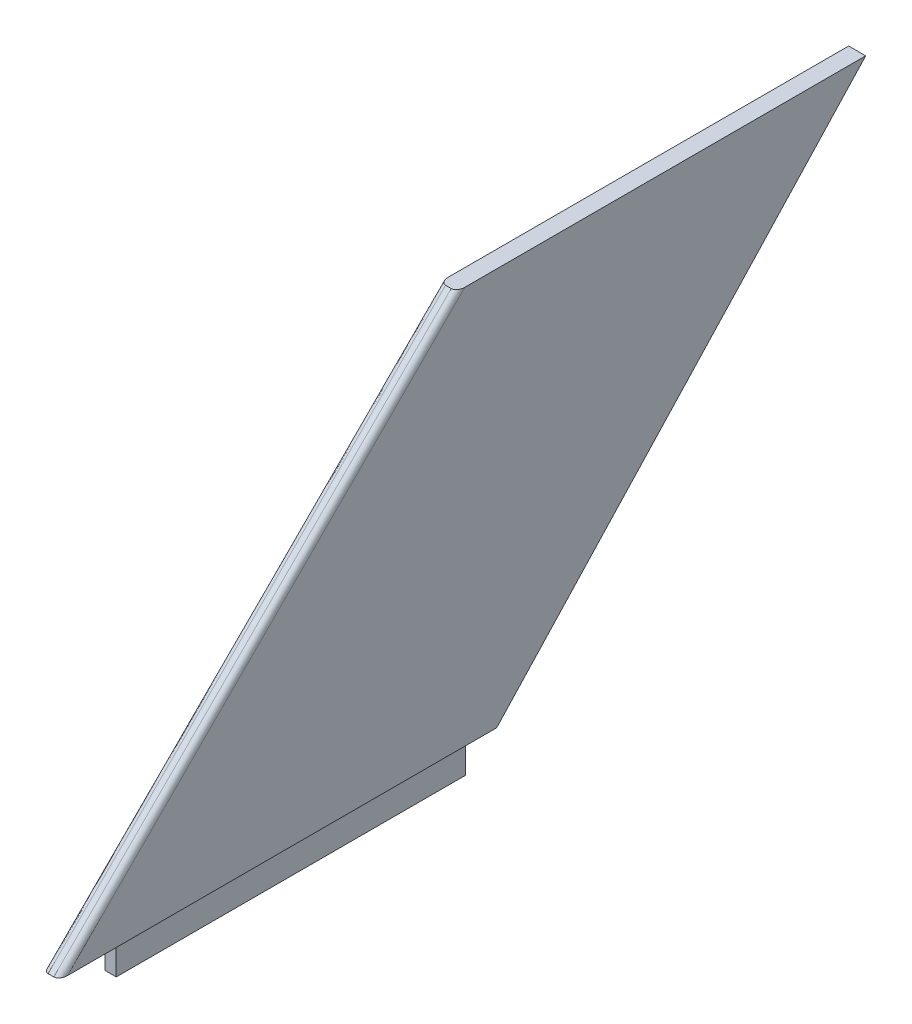
from build123d import *

# Parameters (mm, degrees)
EXTRUDE_1_DEPTH      = 1.5
EXTRUDE_1_DEPTH_BACK = 1.5
EXTRUDE_2_DEPTH      = 1
EXTRUDE_2_DEPTH_BACK = 1
SKETCH_1_3_W         = 61.5
SKETCH_1_3_H         = 5
FILLET_1_R           = 1


with BuildPart() as part:
    # Эскиз1 → Бобышка-Вытянуть1 (new, two sides: drawn at the far end of the back side and taken through both)
    with BuildSketch(Plane(origin=(0, 0, 0), x_dir=(0, 0, -1), z_dir=(1, 0, 0)).offset(-EXTRUDE_1_DEPTH_BACK)):
        Polygon((70, 70), (0, 0), (10.5, 0), (72, 0), (77, 0), (142, 70), align=None)
    extrude(amount=EXTRUDE_1_DEPTH + EXTRUDE_1_DEPTH_BACK)

    # Эскиз1<3> → Бобышка-Вытянуть2 (add, two sides: drawn at the far end of the back side and taken through both)
    with BuildSketch(Plane(origin=(0, 0, 0), x_dir=(0, 0, -1), z_dir=(1, 0, 0)).offset(-EXTRUDE_2_DEPTH_BACK)):
        with Locations((41.25, -2.5)):
            Rectangle(SKETCH_1_3_W, SKETCH_1_3_H)
    extrude(amount=EXTRUDE_2_DEPTH + EXTRUDE_2_DEPTH_BACK)

    # Скругление1
    fillet_1_edges = [part.edges().sort_by_distance(p)[0] for p in [
        (-1.5, 35, -35),
        (1.5, 35, -35),
    ]]
    fillet(fillet_1_edges, radius=FILLET_1_R)


solid = part.part
